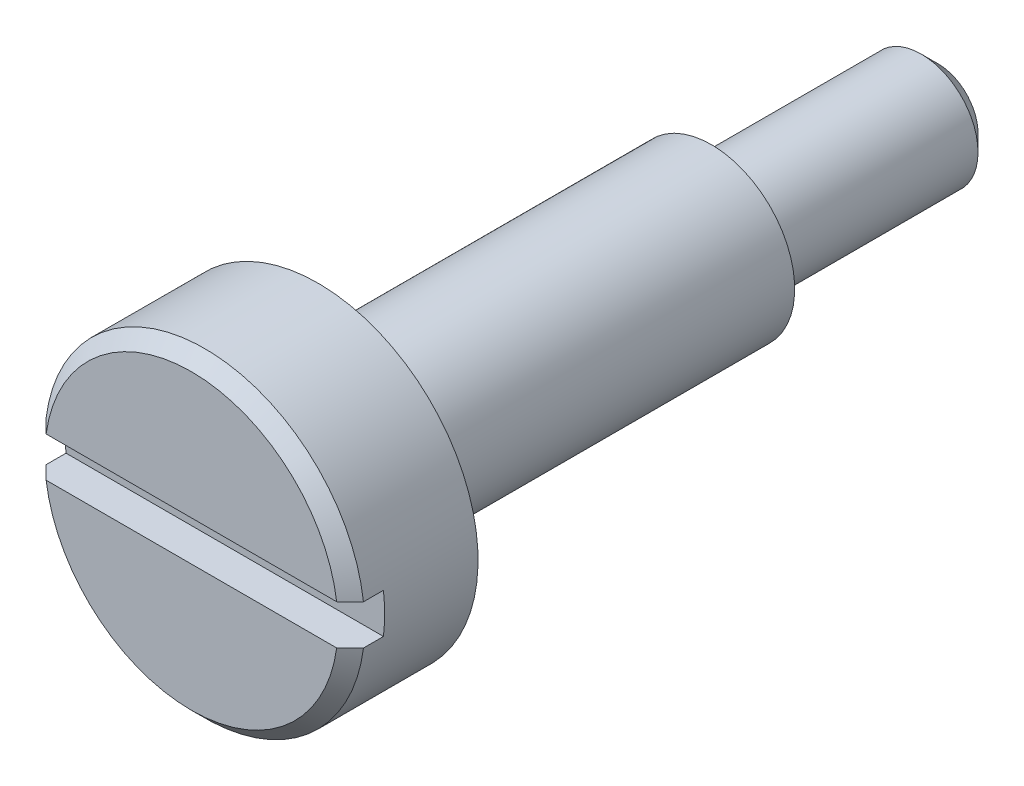
from build123d import *

# Parameters (mm, degrees)
SKETCH2_R           = 2.4
BOSS_EXTRUDE1_DEPTH = 11.2
SKETCH4_OUTSIDE_W   = 9.42
SKETCH4_OUTSIDE_H   = 9.42
SKETCH4_OUTSIDE_R   = 1.25
CUT_EXTRUDE1_DEPTH  = 9.3
SKETCH5_OUTSIDE_W   = 9.42
SKETCH5_OUTSIDE_H   = 9.42
SKETCH5_OUTSIDE_R   = 0.85
CUT_EXTRUDE2_DEPTH  = 3.4
SKETCH6_W           = 5
SKETCH6_H           = 0.6
CUT_EXTRUDE3_DEPTH  = 0.5
CHAMFER1_SIZE       = 0.25
FILLET1_R           = 0.1
CHAMFER2_SIZE       = 0.2


with BuildPart() as part:
    # Sketch2 → Boss-Extrude1 (new body)
    with BuildSketch(Plane.XY):
        Circle(SKETCH2_R)
    extrude(amount=-BOSS_EXTRUDE1_DEPTH)

    # Sketch4 outside → Cut-Extrude1 (cut)
    with BuildSketch(Plane(origin=(0, 0, -11.2), x_dir=(-1, 0, 0), z_dir=(0, 0, -1))):
        Rectangle(SKETCH4_OUTSIDE_W, SKETCH4_OUTSIDE_H)
        Circle(SKETCH4_OUTSIDE_R, mode=Mode.SUBTRACT)
    extrude(amount=-CUT_EXTRUDE1_DEPTH, mode=Mode.SUBTRACT)

    # Sketch5 outside → Cut-Extrude2 (cut)
    with BuildSketch(Plane(origin=(0, 0, -11.2), x_dir=(-1, 0, 0), z_dir=(0, 0, -1))):
        Rectangle(SKETCH5_OUTSIDE_W, SKETCH5_OUTSIDE_H)
        Circle(SKETCH5_OUTSIDE_R, mode=Mode.SUBTRACT)
    extrude(amount=-CUT_EXTRUDE2_DEPTH, mode=Mode.SUBTRACT)

    # Sketch6 → Cut-Extrude3 (cut)
    with BuildSketch(Plane.XY):
        Rectangle(SKETCH6_W, SKETCH6_H)
    extrude(amount=-CUT_EXTRUDE3_DEPTH, mode=Mode.SUBTRACT)

    # Chamfer1
    chamfer1_edges = [part.edges().sort_by_distance(p)[0] for p in [
        (0.85, 0, -11.2),
    ]]
    chamfer(chamfer1_edges, length=CHAMFER1_SIZE)

    # Fillet1
    fillet1_edges = [part.edges().sort_by_distance(p)[0] for p in [
        (1.25, 0, -1.9),
        (0.85, 0, -7.8),
    ]]
    fillet(fillet1_edges, radius=FILLET1_R)

    # Chamfer2
    chamfer2_edges = [part.edges().sort_by_distance(p)[0] for p in [
        (0, -2.4, 0),
        (0, 2.4, 0),
    ]]
    chamfer(chamfer2_edges, length=CHAMFER2_SIZE)


solid = part.part
